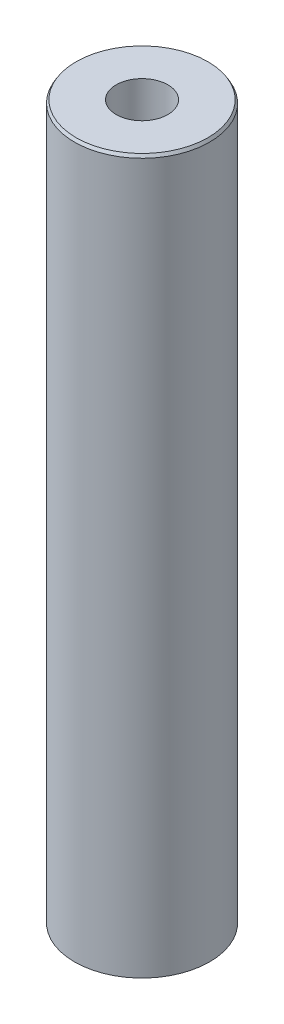
from build123d import *
from OCP.BRepFilletAPI import BRepFilletAPI_MakeChamfer

# Parameters (mm, degrees)
SKETCH1_R           = 17.5
BOSS_EXTRUDE1_DEPTH = 185.014718534
SKETCH2_R           = 6.690083478
CUT_EXTRUDE1_DEPTH  = 187.662653132
CHAMFER1_SIZE       = 0.770848548
CHAMFER1_SIZE2      = 0.445049617


with BuildPart() as part:
    # Sketch1 → Boss-Extrude1 (new body)
    with BuildSketch(Plane(origin=(0, 0, 0), x_dir=(1, 0, 0), z_dir=(0, 1, 0))):
        Circle(SKETCH1_R)
    extrude(amount=BOSS_EXTRUDE1_DEPTH)

    # Sketch2 → Cut-Extrude1 (cut, through all)
    with BuildSketch(Plane(origin=(0, 0, 0), x_dir=(1, 0, 0), z_dir=(0, 1, 0))):
        Circle(SKETCH2_R)
    extrude(amount=CUT_EXTRUDE1_DEPTH, mode=Mode.SUBTRACT)

    # Chamfer1: one chamfer whose edges measure the first distance from different faces: ONE call of the kernel's chamfer builder (chamfer() names one face for all edges)
    chamfer1_edges_1 = [part.edges().sort_by_distance(p)[0] for p in [
        (-17.5, 185.014718534, 0),
    ]]
    chamfer1_side_1 = [part.faces().sort_by_distance(p)[0] for p in [
        (-17.5, 92.507359267, 0),
    ]]
    chamfer1_edges_2 = [part.edges().sort_by_distance(p)[0] for p in [
        (-17.5, 0, 0),
    ]]
    chamfer1_side_2 = [part.faces().sort_by_distance(p)[0] for p in [
        (-17.005025253, 0, 0),
    ]]
    chamfer1 = BRepFilletAPI_MakeChamfer(part.part.solid().wrapped)
    for e in chamfer1_edges_1:
        chamfer1.Add(CHAMFER1_SIZE, CHAMFER1_SIZE2, e.wrapped, chamfer1_side_1[0].wrapped)  # the first distance lies on this face
    for e in chamfer1_edges_2:
        chamfer1.Add(CHAMFER1_SIZE, CHAMFER1_SIZE2, e.wrapped, chamfer1_side_2[0].wrapped)  # the first distance lies on this face
    add(Compound.cast(chamfer1.Shape()), mode=Mode.REPLACE)


solid = part.part
